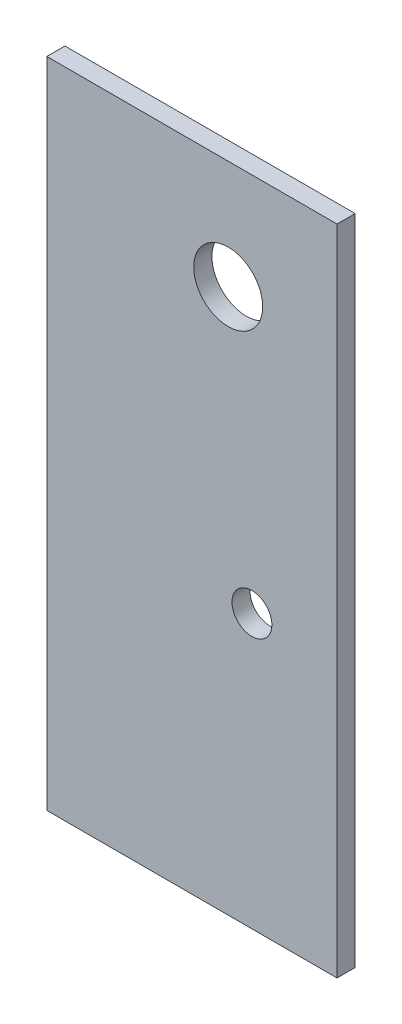
from build123d import *

# Parameters (mm, degrees)
SKETCH1_W           = 80
SKETCH1_H           = 180
SKETCH1_R           = 9.5
BOSS_EXTRUDE1_DEPTH = 5
SKETCH2_R           = 5.5
CUT_EXTRUDE1_DEPTH  = 30


with BuildPart() as part:
    # Sketch1 → Boss-Extrude1 (new body)
    with BuildSketch(Plane.XY):
        with Locations((10, 166)):
            Rectangle(SKETCH1_W, SKETCH1_H)
        with Locations((20, 226)):
            Circle(SKETCH1_R, mode=Mode.SUBTRACT)
    extrude(amount=BOSS_EXTRUDE1_DEPTH)

    # Sketch2 → Cut-Extrude1 (cut)
    with BuildSketch(Plane.XY.offset(5)):
        with Locations((26.536680706, 151.285397643)):
            Circle(SKETCH2_R)
    extrude(amount=-CUT_EXTRUDE1_DEPTH, mode=Mode.SUBTRACT)


solid = part.part
